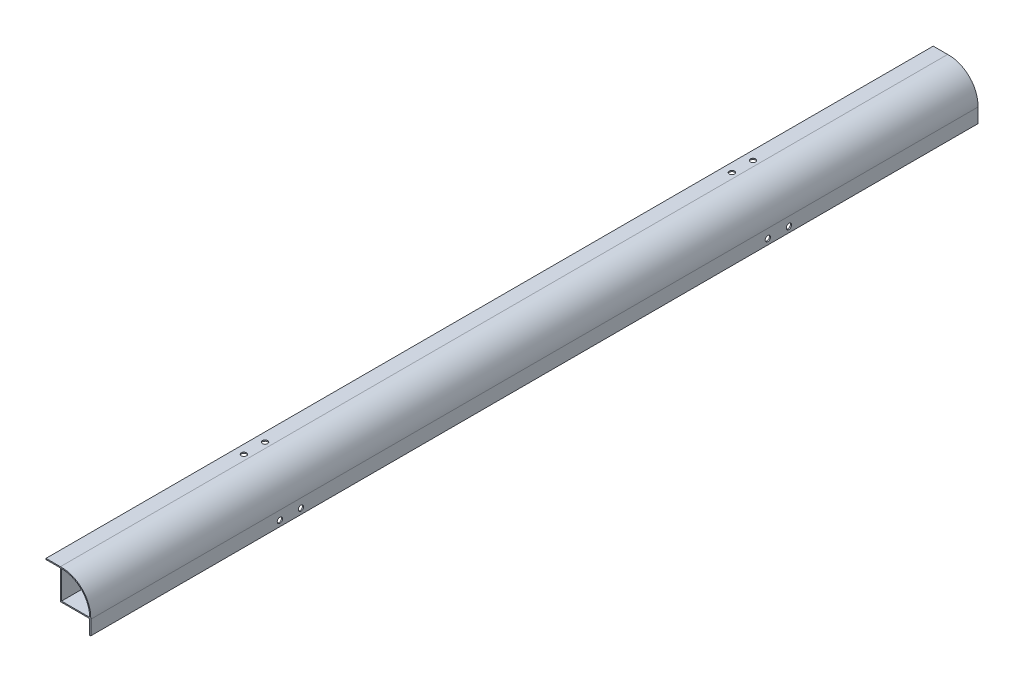
from build123d import *

# Parameters (mm, degrees)
SALIENTE_EXTRUIR1_DEPTH = 400
CROQUIS2_R              = 2.38125
CORTAR_EXTRUIR1_DEPTH   = 10
CROQUIS3_R              = 2.38125
CORTAR_EXTRUIR2_DEPTH   = 10


with BuildPart() as part:
    # Croquis1 → Saliente-Extruir1 (new, symmetric)
    with BuildSketch(Plane.XY):
        with BuildLine():
            Line((-13.7, 12.681053808), (-13.7, -13.7))
            Line((-13.7, -13.7), (12.681053808, -13.7))
            Line((12.681053808, -13.7), (12.681053808, -26.7))
            Line((12.681053808, -26.7), (13.681053808, -26.7))
            Line((13.681053808, -26.7), (13.681053808, -13.7))
            ThreePointArc((13.681053808, -13.7), (5.967619023, 5.967619023), (-13.7, 13.681053808))
            Line((-13.7, 13.681053808), (-26.7, 13.681053808))
            Line((-26.7, 13.681053808), (-26.7, 12.681053808))
            Line((-26.7, 12.681053808), (-13.7, 12.681053808))
        make_face()
        with BuildLine():
            Line((12.7, -12.7), (-12.7, -12.7))
            Line((-12.7, -12.7), (-12.7, 12.7))
            ThreePointArc((-12.7, 12.7), (5.260512242, 5.260512242), (12.7, -12.7))
        make_face(mode=Mode.SUBTRACT)
    extrude(amount=SALIENTE_EXTRUIR1_DEPTH, both=True)

    # Croquis2 → Cortar-Extruir1 (cut)
    with BuildSketch(Plane(origin=(0, 13.681053808, 0), x_dir=(1, 0, 0), z_dir=(0, 1, 0))):
        with Locations((-18.7, -210.5)):
            Circle(CROQUIS2_R)
        with Locations((-18.7, -229.5)):
            Circle(CROQUIS2_R)
        with Locations((-18.7, 229.5)):
            Circle(CROQUIS2_R)
        with Locations((-18.7, 210.5)):
            Circle(CROQUIS2_R)
    extrude(amount=-CORTAR_EXTRUIR1_DEPTH, mode=Mode.SUBTRACT)

    # Croquis3 → Cortar-Extruir2 (cut)
    with BuildSketch(Plane(origin=(13.681053808, 0, 0), x_dir=(0, 0, -1), z_dir=(1, 0, 0))):
        with Locations((-210.5, -21.7)):
            Circle(CROQUIS3_R)
        with Locations((-229.5, -21.7)):
            Circle(CROQUIS3_R)
        with Locations((229.5, -21.7)):
            Circle(CROQUIS3_R)
        with Locations((210.5, -21.7)):
            Circle(CROQUIS3_R)
    extrude(amount=-CORTAR_EXTRUIR2_DEPTH, mode=Mode.SUBTRACT)


solid = part.part
